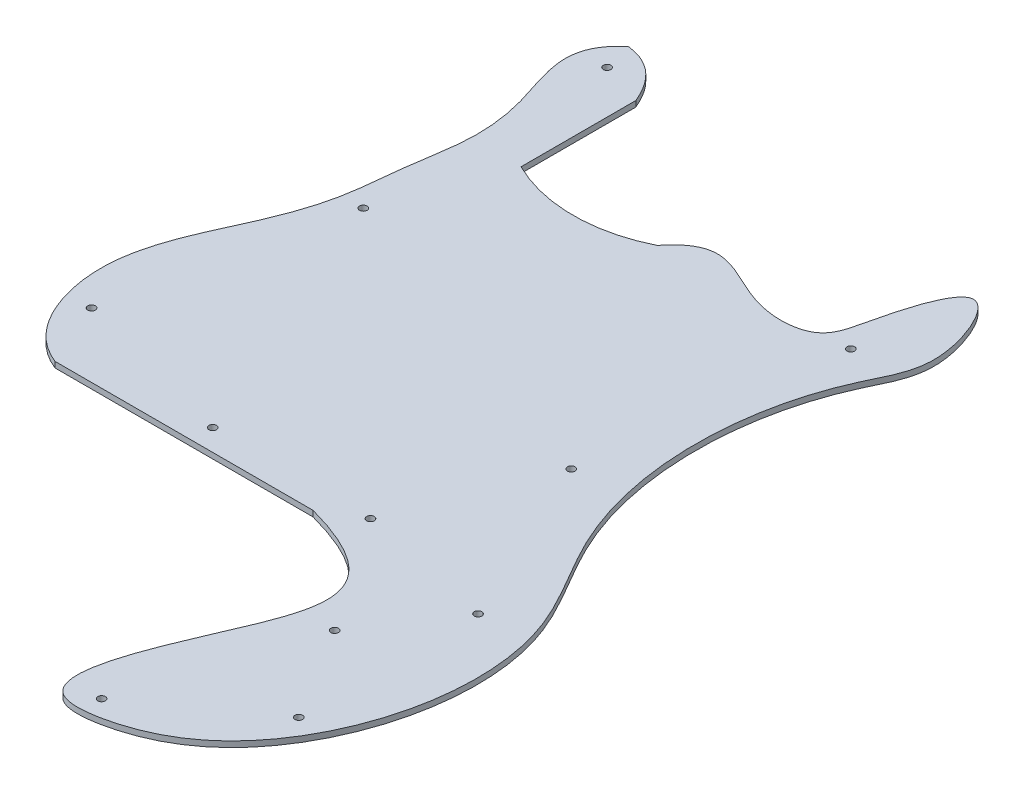
from build123d import *

# Parameters (mm, degrees)
SKETCH1_R           = 1.6764
BOSS_EXTRUDE1_DEPTH = 2.54


with BuildPart() as part:
    # Sketch1 → Boss-Extrude1 (new body)
    with BuildSketch(Plane(origin=(0, 0, 0), x_dir=(1, 0, 0), z_dir=(0, 1, 0))):
        with BuildLine():
            add(Edge.make_bspline(
                [(0, 0), (-11.530009109, 4.514458613), (-23.598116483, 21.764864338), (-27.141921833, 51.196086815), (-19.613077512, 77.06977201), (-7.49782478, 100.945161618), (1.098739727, 126.482448194), (2.538563392, 152.451362426), (7.778248397, 177.773773965), (3.499596198, 210.514145227), (-10.048019094, 234.324881398), (6.35, 247.65)],
                knots=[0, 0, 0, 0, 0.130338526, 0.226963598, 0.325793327, 0.430446663, 0.530898137, 0.627523208, 0.72414828, 0.820773351, 1, 1, 1, 1], degree=3))
            Line((0, 0), (114.3, 0))
            add(Edge.make_bspline(
                [(114.3, 0), (170.623117534, -15.324478473), (142.778708931, -51.014874896), (117.072197564, -130.865304637), (166.910856205, -124.747444082), (211.262432012, -85.645915279), (223.291993333, -5.853996827), (185.767117428, 45.101605611), (169.170891423, 100.622227278), (175.869195185, 155.137482711), (199.796487949, 194.997064768), (178.550153513, 245.052250502), (165.60850021, 201.362130684), (161.132542054, 176.136461295), (122.404810905, 174.743594963), (104.819020559, 197.994682225), (88.9, 177.8)],
                knots=[0, 0, 0, 0, 0.152581141, 0.216738479, 0.247447909, 0.331738729, 0.475087021, 0.544036656, 0.60447099, 0.727585274, 0.76519202, 0.81661101, 0.866124989, 0.890624393, 0.926825212, 1, 1, 1, 1], degree=3))
            ThreePointArc((88.9, 177.8), (58.7375, 170.688), (28.575, 177.8))
            Line((28.575, 177.8), (28.575, 228.6))
            add(Edge.make_bspline(
                [(6.35, 247.65), (21.424126315, 246.030027347), (28.575, 228.6)],
                knots=[0, 0, 0, 1, 1, 1], degree=2))
        make_face()
        with Locations((-12.3825, 28.575)):
            Circle(SKETCH1_R, mode=Mode.SUBTRACT)
        with Locations((60.325, 9.525)):
            Circle(SKETCH1_R, mode=Mode.SUBTRACT)
        with Locations((139.7, -119.0625)):
            Circle(SKETCH1_R, mode=Mode.SUBTRACT)
        with Locations((190.5, -82.55)):
            Circle(SKETCH1_R, mode=Mode.SUBTRACT)
        with Locations((165.1, -41.275)):
            Circle(SKETCH1_R, mode=Mode.SUBTRACT)
        with Locations((130.175, 9.525)):
            Circle(SKETCH1_R, mode=Mode.SUBTRACT)
        with Locations((190.5, -3.175)):
            Circle(SKETCH1_R, mode=Mode.SUBTRACT)
        with Locations((9.525, 127)):
            Circle(SKETCH1_R, mode=Mode.SUBTRACT)
        with Locations((9.525, 234.95)):
            Circle(SKETCH1_R, mode=Mode.SUBTRACT)
        with Locations((155.575, 73.025)):
            Circle(SKETCH1_R, mode=Mode.SUBTRACT)
        with Locations((171.45, 180.975)):
            Circle(SKETCH1_R, mode=Mode.SUBTRACT)
    extrude(amount=BOSS_EXTRUDE1_DEPTH)


solid = part.part
